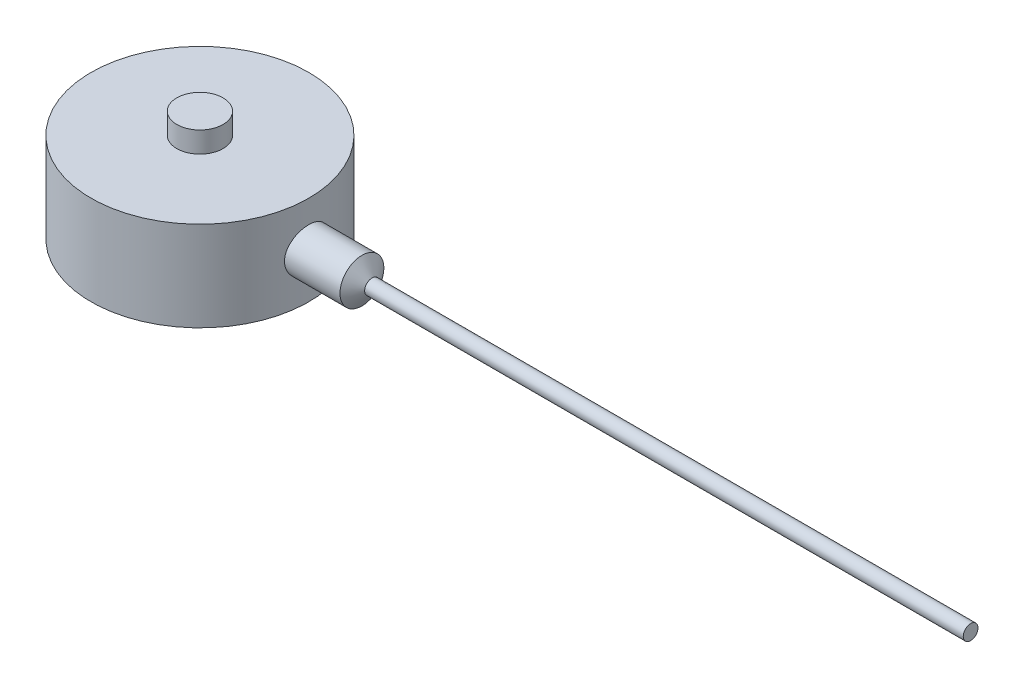
from build123d import *

# Parameters (mm, degrees)
SKETCH1_R    = 25
BASE_DEPTH   = 20.6
SKETCH2_R    = 5.3
BUTTON_DEPTH = 4.8


with BuildPart() as part:
    # Sketch1 → base (new body)
    with BuildSketch(Plane(origin=(0, 0, 0), x_dir=(1, 0, 0), z_dir=(0, 1, 0))):
        Circle(SKETCH1_R)
    extrude(amount=BASE_DEPTH)

    # Sketch2 → button (add)
    with BuildSketch(Plane(origin=(0, 20.6, 0), x_dir=(1, 0, 0), z_dir=(0, 1, 0))):
        Circle(SKETCH2_R)
    extrude(amount=BUTTON_DEPTH)


with BuildPart() as body_2:
    # Sketch3 → cable (revolve)
    with BuildSketch(Plane.XY):
        Polygon((25, 15.335509191), (37.173704012, 15.335509191), (39.498382587, 11.996425419), (176.862374623, 11.996425419), (176.862374623, 10.3), (25, 10.3), (23.480658273, 10.3), (23.480658273, 15.335509191), align=None)
    revolve(axis=Axis((25, 10.3, 0), (1, 0, 0)))


solid = Compound([part.part, body_2.part])
